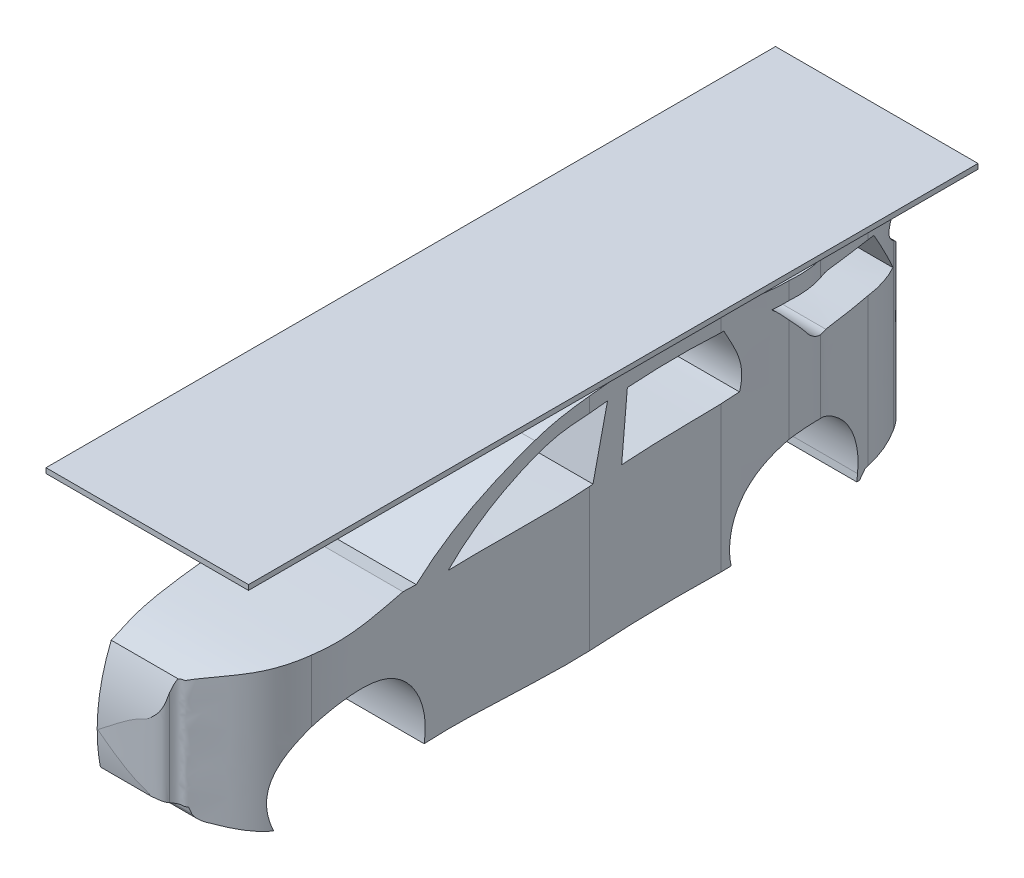
from build123d import *

# Parameters (mm, degrees)
EXTRUDE_1_DEPTH          = 200
EXTRUDE_1_DEPTH_BACK     = 200
SKETCH_1_W               = 1500
SKETCH_1_H               = 800
CUT_EXTRUDE_1_DEPTH      = 940.414711403
CUT_EXTRUDE_1_DEPTH_BACK = 940.414711403
SKETCH_2_W               = 1500
SKETCH_2_H               = 800
SKETCH_3_W               = 400
SKETCH_3_H               = 1441.02812835
EXTRUDE_2_DEPTH          = 10
CUT_EXTRUDE_3_DEPTH      = 799.499266971
CUT_EXTRUDE_3_DEPTH_BACK = 799.499266971


with BuildPart() as part:
    # 스케치1 → 보스-돌출1 (new, two sides: drawn at the far end of the back side and taken through both)
    with BuildSketch(Plane(origin=(0, 0, 0), x_dir=(0, 0, -1), z_dir=(1, 0, 0)).offset(-EXTRUDE_1_DEPTH_BACK)):
        Rectangle(SKETCH_1_W, SKETCH_1_H)
    extrude(amount=EXTRUDE_1_DEPTH + EXTRUDE_1_DEPTH_BACK)

    # 스케치2 → 컷-돌출1 (cut, two sides: drawn at the far end of the back side and taken through both)
    # profile 1 of 4: a face of its own
    with BuildSketch(Plane(origin=(200, 0, 0), x_dir=(0, 0, -1), z_dir=(1, 0, 0)).offset(-CUT_EXTRUDE_1_DEPTH_BACK)):
        Rectangle(SKETCH_2_W, SKETCH_2_H)
        with BuildLine():
            Line((280.3016703, -174.479552934), (-327.065543508, -174.479552934))
            ThreePointArc((-327.065543508, -174.479552934), (-479.302107605, -6.019043458), (-602.802204394, -196.551562452))
            add(Edge.make_bspline(
                [(-665.218829543, -186.149370944), (-635.015956058, -196.094674756), (-602.802204394, -196.551562452)],
                knots=[0, 0, 0, 1, 1, 1], degree=2))
            add(Edge.make_bspline(
                [(-676.497042922, -174.479552934), (-673.760466155, -182.722868989), (-665.218829543, -186.149370944)],
                knots=[0, 0, 0, 1, 1, 1], degree=2))
            Line((-676.497042922, -174.479552934), (-679.296463617, -163.553898584))
            add(Edge.make_bspline(
                [(-706.459813915, -154.598257828), (-693.529746475, -161.339487342), (-679.296463617, -163.553898584)],
                knots=[0, 0, 0, 1, 1, 1], degree=2))
            add(Edge.make_bspline(
                [(-685.004039807, 51.570880503), (-726.008867346, -48.938626349), (-706.459813915, -154.598257828)],
                knots=[0, 0, 0, 1, 1, 1], degree=2))
            add(Edge.make_bspline(
                [(-685.004039807, 51.570880503), (-626.418168439, 77.402725305), (-628.681604579, 85.697029582), (-373.03750551, 110.440650116)],
                knots=[0, 0, 0, 0, 1, 1, 1, 1], degree=3))
            Line((-373.03750551, 110.440650116), (-343.902938975, 106.798829299))
            add(Edge.make_bspline(
                [(-343.902938975, 106.798829299), (-236.881746565, 188.962108021), (-112.208460614, 238.493262607)],
                knots=[0, 0, 0, 1, 1, 1], degree=2))
            add(Edge.make_bspline(
                [(-112.208460614, 238.493262607), (-54.577902422, 262.410703288), (45.738787157, 262.795113766), (145.352408854, 266.376910537), (184.805576631, 266.172328892)],
                knots=[0, 0, 0, 0, 0.605272986, 1, 1, 1, 1], degree=3))
            add(Edge.make_bspline(
                [(184.805576631, 266.172328892), (321.990094692, 267.151938902), (458.836380992, 257.801522366)],
                knots=[0, 0, 0, 1, 1, 1], degree=2))
            add(Edge.make_bspline(
                [(458.836380992, 257.801522366), (544.147551174, 256.760269798), (561.976556812, 229.573355243), (654.333629225, 231.451211203), (654.198586448, 220.277427895), (641.414320093, 214.905781275), (627.986287931, 191.607862927), (668.996397574, 155.942384829), (702.30115572, 122.042835409), (720.273117377, 66.12479994), (712.676275084, 36.872607909), (715.781507378, 19.868059394)],
                knots=[0.240074327, 0.240074327, 0.240074327, 0.240074327, 0.653204439, 0.693687627, 0.700991173, 0.722000926, 0.777859082, 0.852635772, 1.040420077, 1.122675119, 1.240074327, 1.240074327, 1.240074327, 1.240074327], degree=3))
            add(Edge.make_bspline(
                [(717.874242767, -13.061410699), (702.476734622, -0.624260654), (718.917346808, 7.741439982), (715.781507378, 19.868059394)],
                knots=[0, 0, 0, 0, 1, 1, 1, 1], degree=3))
            add(Edge.make_bspline(
                [(669.848851821, -152.414913718), (680.32880085, -150.732798363), (693.655303321, -146.633743812), (712.375122607, -130.670190531), (720.938500393, -117.184378388), (729.822412491, -105.536073864), (719.275494667, -86.773171957), (724.806910789, -56.23904006), (724.98562125, -27.152162502), (717.874242767, -13.061410699)],
                knots=[0, 0, 0, 0, 0.175583659, 0.216534501, 0.388066869, 0.416587639, 0.480300648, 0.716800365, 1, 1, 1, 1], degree=3))
            Line((669.848851821, -152.414913718), (569.410185466, -166.07631805))
            Line((569.410185466, -166.07631805), (556.950840869, -177.741636288))
            Line((556.950840869, -177.741636288), (550.443211911, -176.876579284))
            Line((550.443211911, -176.876579284), (552.21419153, -163.553898584))
            ThreePointArc((552.21419153, -163.553898584), (409.762235993, -7.354940853), (280.3016703, -174.479552934))
        make_face(mode=Mode.SUBTRACT)
    # profile 2 of 4: a face of its own
    with BuildSketch(Plane(origin=(200, 0, 0), x_dir=(0, 0, -1), z_dir=(1, 0, 0)).offset(-CUT_EXTRUDE_1_DEPTH_BACK)):
        with BuildLine():
            Line((2.548019088, 106.867745759), (32.920491981, 233.348367165))
            add(Edge.make_bspline(
                [(-278.11256504, 96.861064809), (-234.879809396, 139.586151047), (-164.46265644, 190.562691728), (-73.199596618, 227.714862513), (-16.660040428, 231.372598721), (12.813994109, 232.629014479), (32.920491981, 233.348367165)],
                knots=[0, 0, 0, 0, 0.268354736, 0.38867973, 0.430559093, 0.520379589, 0.520379589, 0.520379589, 0.520379589], degree=3))
            add(Edge.make_bspline(
                [(-278.11256504, 96.861064809), (-184.958099019, 99.529726233), (-91.133847424, 103.750045841), (2.548019088, 106.867745759)],
                knots=[0, 0, 0, 0, 0.453727526, 0.453727526, 0.453727526, 0.453727526], degree=3))
        make_face()
    # profile 3 of 4: a face of its own
    with BuildSketch(Plane(origin=(200, 0, 0), x_dir=(0, 0, -1), z_dir=(1, 0, 0)).offset(-CUT_EXTRUDE_1_DEPTH_BACK)):
        with BuildLine():
            add(Edge.make_bspline(
                [(265.714775142, 234.746172589), (284.523703983, 197.991257641), (310.472405695, 164.170137873), (296.168975559, 115.684691988)],
                knots=[0, 0, 0, 0, 1, 1, 1, 1], degree=3))
            add(Edge.make_bspline(
                [(73.807418163, 234.66441277), (76.819009633, 234.751743988), (140.759658921, 236.557078876), (204.826980771, 237.229960502), (265.714775142, 234.746172589)],
                knots=[0.581238367, 0.581238367, 0.581238367, 0.581238367, 0.594679356, 0.86658068, 0.86658068, 0.86658068, 0.86658068], degree=3))
            Line((73.807418163, 234.66441277), (62.097439489, 108.676500581))
            add(Edge.make_bspline(
                [(62.097439489, 108.676500581), (83.633083705, 109.258920997), (153.611053505, 110.866137182), (231.2577054, 111.236707569), (288.219123221, 114.737247413), (296.168975559, 115.684691988)],
                knots=[0.54990918, 0.54990918, 0.54990918, 0.54990918, 0.654320294, 0.889445499, 0.92817218, 0.92817218, 0.92817218, 0.92817218], degree=3))
        make_face()
    # profile 4 of 4: a face of its own
    with BuildSketch(Plane(origin=(200, 0, 0), x_dir=(0, 0, -1), z_dir=(1, 0, 0)).offset(-CUT_EXTRUDE_1_DEPTH_BACK)):
        with BuildLine():
            add(Edge.make_bspline(
                [(477.763475442, 126.518753016), (535.358001856, 124.015625046), (593.311640556, 128.165377801), (650.916541317, 125.075287232)],
                knots=[0, 0, 0, 0, 0.787098291, 0.787098291, 0.787098291, 0.787098291], degree=3))
            Line((650.916541317, 125.075287232), (590.958959886, 221.425157419))
            Line((590.958959886, 221.425157419), (355.196457688, 228.584879062))
            add(Edge.make_bspline(
                [(355.196457688, 228.584879062), (364.631420441, 221.15885575), (386.521984795, 197.053118933), (409.172114208, 173.728683456), (422.280592916, 157.837541555)],
                knots=[0, 0, 0, 0, 0.367444945, 1, 1, 1, 1], degree=3))
            add(Edge.make_bspline(
                [(477.763475442, 126.518753016), (474.97301074, 126.179262094), (453.447110084, 126.476283167), (432.523179728, 143.256485346), (422.280592916, 157.837541555)],
                knots=[0, 0, 0, 0, 0.128765335, 1, 1, 1, 1], degree=3))
        make_face()
    extrude(amount=CUT_EXTRUDE_1_DEPTH + CUT_EXTRUDE_1_DEPTH_BACK, mode=Mode.SUBTRACT)

    # 스케치8 → 컷-돌출3 (cut, two sides: drawn at the far end of the back side and taken through both)
    with BuildSketch(Plane(origin=(0, 62.760223533, 0), x_dir=(1, 0, 0), z_dir=(0, 1, 0)).offset(-CUT_EXTRUDE_3_DEPTH_BACK)):
        with BuildLine():
            Line((-98.913574885, -712.770978186), (-98.913574885, 721.958573299))
            add(Edge.make_bspline(
                [(-98.913574885, 721.958573299), (-19.965770394, 720.517219462), (55.02497106, 696.072358963)],
                knots=[0, 0, 0, 1, 1, 1], degree=2))
            add(Edge.make_bspline(
                [(55.02497106, 696.072358963), (89.572427625, 685.359094713), (107.397692453, 654.002468007)],
                knots=[0, 0, 0, 1, 1, 1], degree=2))
            add(Edge.make_bspline(
                [(107.397692453, 654.002468007), (128.658431099, 618.684601185), (133.664932484, 577.345242633)],
                knots=[0, 0, 0, 1, 1, 1], degree=2))
            add(Edge.make_bspline(
                [(133.664932484, 577.345242633), (139.089083387, 549.269382043), (144.147772128, 510.85147114), (150.385991516, 471.769032928), (155.647245359, 461.557161237)],
                knots=[0, 0, 0, 0, 0.714492967, 1, 1, 1, 1], degree=3))
            add(Edge.make_bspline(
                [(155.647245359, 461.557161237), (167.249802574, 426.367799954), (165.617440531, 389.382778484)],
                knots=[0, 0, 0, 1, 1, 1], degree=2))
            add(Edge.make_bspline(
                [(165.617440531, 389.382778484), (167.92643414, 345.919092186), (158.297893958, 302.962659189), (160.739098951, 259.548657859)],
                knots=[0, 0, 0, 0, 1, 1, 1, 1], degree=3))
            add(Edge.make_bspline(
                [(160.739098951, 259.548657859), (157.539358725, 127.050077026), (165.617440531, -5.08137462)],
                knots=[0, 0, 0, 1, 1, 1], degree=2))
            add(Edge.make_bspline(
                [(165.617440531, -5.08137462), (170.091228167, -120.849330337), (142.79418381, -304.277553749), (184.324252959, -485.384105899), (163.208386829, -551.385826663)],
                knots=[0, 0, 0, 0, 0.63596076, 1, 1, 1, 1], degree=3))
            add(Edge.make_bspline(
                [(163.208386829, -551.385826663), (157.118577942, -573.590903751), (131.635582633, -626.037370848), (82.640683902, -654.784263042), (49.776077036, -677.773832264), (41.407223561, -684.908671778), (33.234581187, -681.373813488), (24.919338315, -693.818556095)],
                knots=[0, 0, 0, 0, 0.360198699, 0.838600791, 0.896483243, 0.934296555, 1, 1, 1, 1], degree=3))
            add(Edge.make_bspline(
                [(24.919338315, -693.818556095), (22.181594016, -701.488637454), (10.084395595, -704.846626133), (-4.541009825, -707.392865054), (-37.615814212, -709.592554544), (-63.346847258, -712.710419065), (-96.677442028, -712.770978186)],
                knots=[0, 0, 0, 0, 0.174630762, 0.264684504, 0.347221428, 0.985819484, 0.985819484, 0.985819484, 0.985819484], degree=3))
            Line((-96.677442028, -712.770978186), (200, -712.770978186))
            Line((200, -712.770978186), (200, 728.257150164))
            Line((200, 728.257150164), (-200, 728.257150164))
            Line((-200, 728.257150164), (-200, -712.770978186))
            Line((-200, -712.770978186), (-98.913574885, -712.770978186))
        make_face()
    extrude(amount=CUT_EXTRUDE_3_DEPTH + CUT_EXTRUDE_3_DEPTH_BACK, mode=Mode.SUBTRACT)


with BuildPart() as body_2:
    # 스케치3 → 보스-돌출2 (new body)
    with BuildSketch(Plane(origin=(0, 300, 0), x_dir=(1, 0, 0), z_dir=(0, 1, 0))):
        with Locations((0, 7.743085989)):
            Rectangle(SKETCH_3_W, SKETCH_3_H)
    extrude(amount=EXTRUDE_2_DEPTH)


solid = Compound([part.part, body_2.part])
